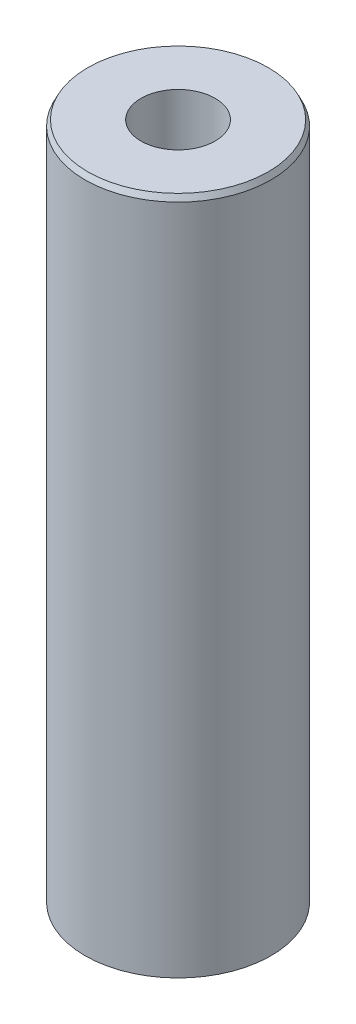
from build123d import *
from OCP.BRepFilletAPI import BRepFilletAPI_MakeChamfer

# Parameters (mm, degrees)
SKETCH1_R           = 55
BOSS_EXTRUDE1_DEPTH = 402.264997529
SKETCH2_R           = 21.927611644
CUT_EXTRUDE1_DEPTH  = 410.715911622
CHAMFER1_SIZE       = 3.34187539
CHAMFER1_SIZE2      = 1.632844896


with BuildPart() as part:
    # Sketch1 → Boss-Extrude1 (new body)
    with BuildSketch(Plane(origin=(0, 0, 0), x_dir=(1, 0, 0), z_dir=(0, 1, 0))):
        Circle(SKETCH1_R)
    extrude(amount=BOSS_EXTRUDE1_DEPTH)

    # Sketch2 → Cut-Extrude1 (cut, through all)
    with BuildSketch(Plane(origin=(0, 0, 0), x_dir=(1, 0, 0), z_dir=(0, 1, 0))):
        Circle(SKETCH2_R)
    extrude(amount=CUT_EXTRUDE1_DEPTH, mode=Mode.SUBTRACT)

    # Chamfer1: one chamfer whose edges measure the first distance from different faces: ONE call of the kernel's chamfer builder (chamfer() names one face for all edges)
    chamfer1_edges_1 = [part.edges().sort_by_distance(p)[0] for p in [
        (-55, 402.264997529, 0),
    ]]
    chamfer1_side_1 = [part.faces().sort_by_distance(p)[0] for p in [
        (-55, 201.132498764, 0),
    ]]
    chamfer1_edges_2 = [part.edges().sort_by_distance(p)[0] for p in [
        (-55, 0, 0),
    ]]
    chamfer1_side_2 = [part.faces().sort_by_distance(p)[0] for p in [
        (-53.444365081, 0, 0),
    ]]
    chamfer1 = BRepFilletAPI_MakeChamfer(part.part.solid().wrapped)
    for e in chamfer1_edges_1:
        chamfer1.Add(CHAMFER1_SIZE, CHAMFER1_SIZE2, e.wrapped, chamfer1_side_1[0].wrapped)  # the first distance lies on this face
    for e in chamfer1_edges_2:
        chamfer1.Add(CHAMFER1_SIZE, CHAMFER1_SIZE2, e.wrapped, chamfer1_side_2[0].wrapped)  # the first distance lies on this face
    add(Compound.cast(chamfer1.Shape()), mode=Mode.REPLACE)


solid = part.part
